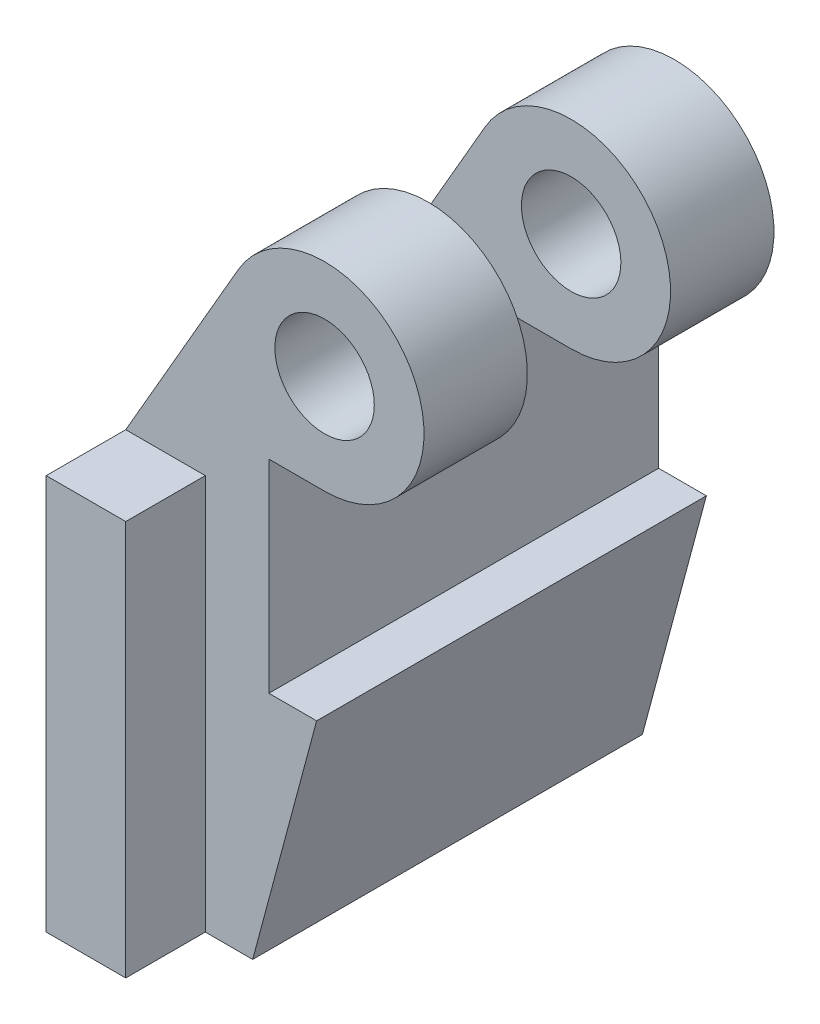
from build123d import *

# Parameters (mm, degrees)
OUTER_START                              = 2.286
OUTER_CLAMP_LATCH_CUT_EXTRUDE5_DEPTH     = 2.794
OUTER_START_2                            = -1.143
OUTER_CLAMP_LATCH_CUT_EXTRUDE5_2_DEPTH   = 2.4129999
OUTER_START_3                            = -0.508
OUTER_CLAMP_LATCH_CUT_EXTRUDE5_3_OUTLI_R = 0.79375
OUTER_CLAMP_LATCH_CUT_EXTRUDE5_3_DEPTH   = 1.651
OUTER_START_4                            = 3.429
OUTER_CLAMP_LATCH_CUT_EXTRUDE5_4_OUTLI_R = 0.79375
OUTER_CLAMP_LATCH_CUT_EXTRUDE5_4_DEPTH   = 1.651
OUTER_START_5                            = 5.08
OUTER_CLAMP_LATCH_CUT_EXTRUDE5_5_DEPTH   = 1.27
OUTER_START_6                            = 1.2699999
OUTER_CLAMP_LATCH_CUT_EXTRUDE5_6_DEPTH   = 1.0160001
OUTER_START_7                            = -5.207
OUTER_CLAMP_LATCH_CUT_EXTRUDE5_7_OUTLI_R = 0.508
OUTER_CLAMP_LATCH_CUT_EXTRUDE5_7_DEPTH   = 2.54
SKETCH1_W                                = 0.762
SKETCH1_H                                = 1.524
CUT_EXTRUDE1_DEPTH                       = 14.441616644


with BuildPart() as part:
    # <Outer Clamp Latch>-<Cut-Extrude5>: read off the stored shape, not the designer's step
    # <Outer Clamp Latch>-<Cut-Extrude5> outline → <Outer Clamp Latch>-<Cut-Extrude5> (new body)
    with BuildSketch(Plane.XY.offset(OUTER_START)):
        Polygon((-4.699, -4.318), (-4.699, -2.667), (-6.596292399, -2.667), (-6.985, -3.340261314), (-6.985, -9.652), (-4.957886423, -9.652), (-3.937, -5.842), (-3.937, -4.318), align=None)
    extrude(amount=OUTER_CLAMP_LATCH_CUT_EXTRUDE5_DEPTH)

    # Outer Clamp Latch_-_Cut-Extrude5 4 outli → Outer Clamp Latch_-_Cut-Extrude5 4 (add)
    with BuildSketch(Plane.XY.offset(OUTER_START_4)):
        with BuildLine():
            Line((-4.699, -2.667), (-4.699, -2.6035))
            Line((-4.699, -2.6035), (-3.81, -2.6035))
            ThreePointArc((-3.81, -2.6035), (-2.435184671, -0.222249999), (-5.184815329, -0.22225))
            Line((-5.184815329, -0.22225), (-6.596292399, -2.667))
            Line((-6.596292399, -2.667), (-4.699, -2.667))
        make_face()
        with Locations((-3.81, -1.016)):
            Circle(OUTER_CLAMP_LATCH_CUT_EXTRUDE5_4_OUTLI_R, mode=Mode.SUBTRACT)
    extrude(amount=OUTER_CLAMP_LATCH_CUT_EXTRUDE5_4_DEPTH)

    # Outer Clamp Latch_-_Cut-Extrude5 5 outli → Outer Clamp Latch_-_Cut-Extrude5 5 (add)
    with BuildSketch(Plane.XY.offset(OUTER_START_5)):
        Polygon((-5.715, -3.340261314), (-6.985, -3.340261314), (-6.985, -9.652), (-5.715, -9.652), (-5.715, -5.207), align=None)
    extrude(amount=OUTER_CLAMP_LATCH_CUT_EXTRUDE5_5_DEPTH)



with BuildPart() as body_2:
    # Outer Clamp Latch_-_Cut-Extrude5 2 outli → Outer Clamp Latch_-_Cut-Extrude5 2 (new body)
    with BuildSketch(Plane.XY.offset(OUTER_START_2)):
        Polygon((-4.699, -4.318), (-4.699, -2.667), (-6.596292399, -2.667), (-6.985, -3.340261314), (-6.985, -9.652), (-4.957886423, -9.652), (-3.937, -5.842), (-3.937, -4.318), align=None)
    extrude(amount=OUTER_CLAMP_LATCH_CUT_EXTRUDE5_2_DEPTH)

    # Outer Clamp Latch_-_Cut-Extrude5 3 outli → Outer Clamp Latch_-_Cut-Extrude5 3 (add)
    with BuildSketch(Plane.XY.offset(OUTER_START_3)):
        with BuildLine():
            Line((-4.699, -2.667), (-4.699, -2.6035))
            Line((-4.699, -2.6035), (-3.81, -2.6035))
            ThreePointArc((-3.81, -2.6035), (-2.435184671, -0.222249999), (-5.184815329, -0.22225))
            Line((-5.184815329, -0.22225), (-6.596292399, -2.667))
            Line((-6.596292399, -2.667), (-4.699, -2.667))
        make_face()
        with Locations((-3.81, -1.016)):
            Circle(OUTER_CLAMP_LATCH_CUT_EXTRUDE5_3_OUTLI_R, mode=Mode.SUBTRACT)
    extrude(amount=OUTER_CLAMP_LATCH_CUT_EXTRUDE5_3_DEPTH)


with BuildPart() as part_1:
    add(part.part)

    add(body_2.part)  # Outer Clamp Latch_-_Cut-Extrude5 6 merges body 2
    # Outer Clamp Latch_-_Cut-Extrude5 6 outli → Outer Clamp Latch_-_Cut-Extrude5 6 (add)
    with BuildSketch(Plane.XY.offset(OUTER_START_6)):
        Polygon((-4.699, -4.318), (-4.699, -2.667), (-6.596292399, -2.667), (-6.985, -3.340261314), (-6.985, -9.652), (-4.957886423, -9.652), (-3.937, -5.842), (-3.937, -4.318), align=None)
    extrude(amount=OUTER_CLAMP_LATCH_CUT_EXTRUDE5_6_DEPTH)

    # Outer Clamp Latch_-_Cut-Extrude5 7 outli → Outer Clamp Latch_-_Cut-Extrude5 7 (cut)
    with BuildSketch(Plane(origin=(0, 0, 0), x_dir=(1, 0, 0), z_dir=(0, 1, 0)).offset(OUTER_START_7)):
        with Locations((-5.715, -1.778)):
            Circle(OUTER_CLAMP_LATCH_CUT_EXTRUDE5_7_OUTLI_R)
    extrude(amount=OUTER_CLAMP_LATCH_CUT_EXTRUDE5_7_DEPTH, mode=Mode.SUBTRACT)

    # Sketch1 → Cut-Extrude1 (cut, through all)
    with BuildSketch(Plane.XY.offset(5.08)):
        with Locations((-4.318, -5.08)):
            Rectangle(SKETCH1_W, SKETCH1_H)
    extrude(amount=-CUT_EXTRUDE1_DEPTH, mode=Mode.SUBTRACT)


solid = part_1.part
